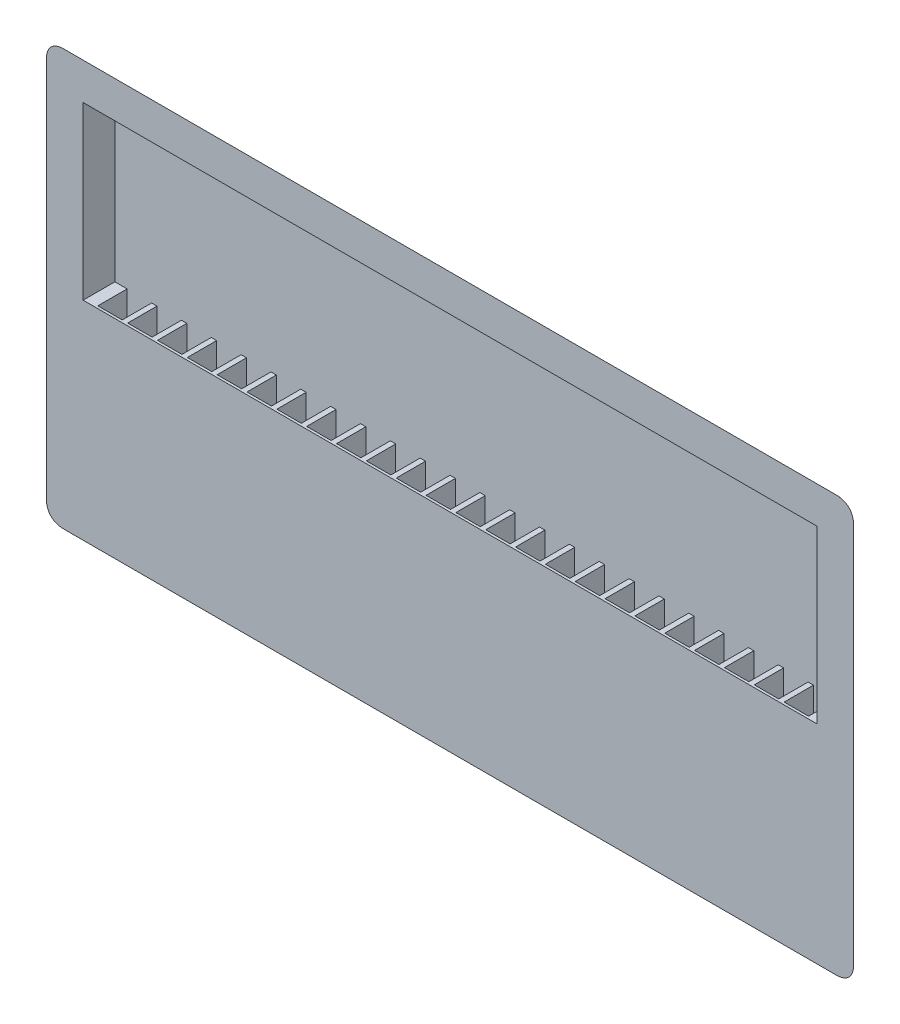
from build123d import *

# Parameters (mm, degrees)
SZKIC1_W                    = 300
SZKIC1_H                    = 140
DODANIE_WYCI_GNI_CIE1_DEPTH = 15
DODANIE_WYCI_GNI_CIE1_DRAFT = -45
SZKIC2_W                    = 300
SZKIC2_H                    = 70
WYTNIJ_WYCI_GNI_CIE1_DEPTH  = 15
SZKIC3_W                    = 10
SZKIC3_H                    = 12
WYTNIJ_WYCI_GNI_CIE2_DEPTH  = 108
ZAOKR_GLENIE1_R             = 10


with BuildPart() as part:
    # Szkic1 → Dodanie-wyciągnięcie1 (with draft: the straight prism first)
    with BuildSketch(Plane.XY):
        Rectangle(SZKIC1_W, SZKIC1_H)
    extrude(amount=DODANIE_WYCI_GNI_CIE1_DEPTH)
    # Dodanie-wyciągnięcie1: the draft: its side faces are tilted about the plane it starts from
    dodanie_wyci_gni_cie1_sides = [part.faces().sort_by_distance(p)[0] for p in [
        (0, -70, 7.5),
        (150, 0, 7.5),
        (0, 70, 7.5),
        (-150, 0, 7.5),
    ]]
    draft(dodanie_wyci_gni_cie1_sides, Plane.XY, DODANIE_WYCI_GNI_CIE1_DRAFT)

    # Szkic2 → Wytnij-wyciągnięcie1 (cut)
    with BuildSketch(Plane(origin=(0, 0, 2), x_dir=(-1, 0, 0), z_dir=(0, 0, -1))):
        with Locations((0, 35)):
            Rectangle(SZKIC2_W, SZKIC2_H)
    extrude(amount=-WYTNIJ_WYCI_GNI_CIE1_DEPTH, mode=Mode.SUBTRACT)

    # Szkic3 → Wytnij-wyciągnięcie2 (cut)
    with BuildSketch(Plane(origin=(0, 0, 0), x_dir=(1, 0, 0), z_dir=(0, 1, 0))):
        with Locations((-140, -8)):
            Rectangle(SZKIC3_W, SZKIC3_H)
        with Locations((-127.8, -8)):
            Rectangle(SZKIC3_W, SZKIC3_H)
        with Locations((-115.6, -8)):
            Rectangle(SZKIC3_W, SZKIC3_H)
        with Locations((-103.4, -8)):
            Rectangle(SZKIC3_W, SZKIC3_H)
        with Locations((-91.2, -8)):
            Rectangle(SZKIC3_W, SZKIC3_H)
        with Locations((-79, -8)):
            Rectangle(SZKIC3_W, SZKIC3_H)
        with Locations((-66.8, -8)):
            Rectangle(SZKIC3_W, SZKIC3_H)
        with Locations((-54.6, -8)):
            Rectangle(SZKIC3_W, SZKIC3_H)
        with Locations((-42.4, -8)):
            Rectangle(SZKIC3_W, SZKIC3_H)
        with Locations((-30.2, -8)):
            Rectangle(SZKIC3_W, SZKIC3_H)
        with Locations((-18, -8)):
            Rectangle(SZKIC3_W, SZKIC3_H)
        with Locations((-5.8, -8)):
            Rectangle(SZKIC3_W, SZKIC3_H)
        with Locations((6.4, -8)):
            Rectangle(SZKIC3_W, SZKIC3_H)
        with Locations((18.6, -8)):
            Rectangle(SZKIC3_W, SZKIC3_H)
        with Locations((30.8, -8)):
            Rectangle(SZKIC3_W, SZKIC3_H)
        with Locations((43, -8)):
            Rectangle(SZKIC3_W, SZKIC3_H)
        with Locations((55.2, -8)):
            Rectangle(SZKIC3_W, SZKIC3_H)
        with Locations((67.4, -8)):
            Rectangle(SZKIC3_W, SZKIC3_H)
        with Locations((79.6, -8)):
            Rectangle(SZKIC3_W, SZKIC3_H)
        with Locations((91.8, -8)):
            Rectangle(SZKIC3_W, SZKIC3_H)
        with Locations((104, -8)):
            Rectangle(SZKIC3_W, SZKIC3_H)
        with Locations((116.2, -8)):
            Rectangle(SZKIC3_W, SZKIC3_H)
        with Locations((128.4, -8)):
            Rectangle(SZKIC3_W, SZKIC3_H)
        with Locations((140.6, -8)):
            Rectangle(SZKIC3_W, SZKIC3_H)
    extrude(amount=-WYTNIJ_WYCI_GNI_CIE2_DEPTH, mode=Mode.SUBTRACT)

    # Zaokrąglenie1
    # the kernel refuses this fillet: 10 mm, written as the material it takes off along each edge
    with BuildSketch(Plane(origin=(-145.857864376, 65.857864376, 10), x_dir=(-0.35740674433659364, 0.8628562094610169, 0.3574067443365923), z_dir=(-0.2705980500730978, 0.2705980500730978, -0.9238795325112871))) as zaokr_glenie1_piece_1_section:
        Polygon((-13.907299812, -13.907299812), (13.907299812, -13.907299812), (13.907299812, 13.907299812), (-13.907299812, 13.907299812), align=None)
    zaokr_glenie1_piece_1 = extrude(amount=13.907299812, mode=Mode.PRIVATE)
    zaokr_glenie1_piece_1 = split(zaokr_glenie1_piece_1, bisect_by=Plane(origin=(-145.857864376, 65.857864376, 10), z_dir=(0, 1, 0)), keep=Keep.TOP, mode=Mode.PRIVATE)
    zaokr_glenie1_piece_1 = split(zaokr_glenie1_piece_1, bisect_by=Plane(origin=(-145.857864376, 65.857864376, 10), z_dir=(-1, 0, 0)), keep=Keep.TOP, mode=Mode.PRIVATE)
    zaokr_glenie1_piece_1 = split(zaokr_glenie1_piece_1, bisect_by=Plane(origin=(-145.857864376, 65.857864376, 10), z_dir=(0.5773502691896265, -0.5773502691896265, -0.5773502691896244)), keep=Keep.TOP, mode=Mode.PRIVATE)
    zaokr_glenie1_piece_1 = split(zaokr_glenie1_piece_1, bisect_by=Plane(origin=(-152.928932188, 65.857864376, 2.928932188), z_dir=(0.7071067811865462, 0, 0.7071067811865488)), keep=Keep.TOP, mode=Mode.PRIVATE)
    zaokr_glenie1_piece_1 = split(zaokr_glenie1_piece_1, bisect_by=Plane(origin=(-145.857864376, 65.857864376, 0), z_dir=(0, 0, 1)), keep=Keep.TOP, mode=Mode.PRIVATE)
    zaokr_glenie1_piece_1 = split(zaokr_glenie1_piece_1, bisect_by=Plane(origin=(-145.857864376, 72.928932188, 2.928932188), z_dir=(0, -0.7071067811865462, 0.7071067811865488)), keep=Keep.TOP, mode=Mode.PRIVATE)
    zaokr_glenie1_piece_1 = zaokr_glenie1_piece_1 - Plane(origin=(-145.857864376, 65.857864376, 10), x_dir=(0.2705980500730978, -0.2705980500730978, 0.9238795325112871), z_dir=(-0.35740674433659364, 0.8628562094610169, 0.3574067443365923)) * Sphere(ZAOKR_GLENIE1_R, mode=Mode.PRIVATE)
    add(zaokr_glenie1_piece_1, mode=Mode.SUBTRACT)
    with BuildSketch(Plane(origin=(145.857864376, 65.857864376, 10), x_dir=(-0.7071067811865475, 0.7071067811865475, 0), z_dir=(0.2705980500730978, 0.2705980500730978, -0.9238795325112871))) as zaokr_glenie1_piece_2_section:
        Polygon((-13.907299812, -13.907299812), (13.907299812, -13.907299812), (13.907299812, 13.907299812), (-13.907299812, 13.907299812), align=None)
    zaokr_glenie1_piece_2 = extrude(amount=13.907299812, mode=Mode.PRIVATE)
    zaokr_glenie1_piece_2 = split(zaokr_glenie1_piece_2, bisect_by=Plane(origin=(145.857864376, 65.857864376, 10), z_dir=(0, 1, 0)), keep=Keep.TOP, mode=Mode.PRIVATE)
    zaokr_glenie1_piece_2 = split(zaokr_glenie1_piece_2, bisect_by=Plane(origin=(145.857864376, 65.857864376, 10), z_dir=(-0.5773502691896265, -0.5773502691896265, -0.5773502691896244)), keep=Keep.TOP, mode=Mode.PRIVATE)
    zaokr_glenie1_piece_2 = split(zaokr_glenie1_piece_2, bisect_by=Plane(origin=(145.857864376, 65.857864376, 10), z_dir=(1, 0, 0)), keep=Keep.TOP, mode=Mode.PRIVATE)
    zaokr_glenie1_piece_2 = split(zaokr_glenie1_piece_2, bisect_by=Plane(origin=(145.857864376, 65.857864376, 0), z_dir=(0, 0, 1)), keep=Keep.TOP, mode=Mode.PRIVATE)
    zaokr_glenie1_piece_2 = split(zaokr_glenie1_piece_2, bisect_by=Plane(origin=(152.928932188, 65.857864376, 2.928932188), z_dir=(-0.7071067811865462, 0, 0.7071067811865488)), keep=Keep.TOP, mode=Mode.PRIVATE)
    zaokr_glenie1_piece_2 = split(zaokr_glenie1_piece_2, bisect_by=Plane(origin=(145.857864376, 72.928932188, 2.928932188), z_dir=(0, -0.7071067811865462, 0.7071067811865488)), keep=Keep.TOP, mode=Mode.PRIVATE)
    zaokr_glenie1_piece_2 = zaokr_glenie1_piece_2 - Plane(origin=(145.857864376, 65.857864376, 10), x_dir=(-0.2705980500730978, -0.2705980500730978, 0.9238795325112871), z_dir=(-0.7071067811865475, 0.7071067811865475, 0)) * Sphere(ZAOKR_GLENIE1_R, mode=Mode.PRIVATE)
    add(zaokr_glenie1_piece_2, mode=Mode.SUBTRACT)
    with BuildSketch(Plane(origin=(-150, 65.857864376, 0), x_dir=(-0.7071067811865438, 0, 0.7071067811865511), z_dir=(0, -1, 0))) as zaokr_glenie1_piece_3:
        with BuildLine():
            CenterArc((ZAOKR_GLENIE1_R * 0.414213562373, -ZAOKR_GLENIE1_R), ZAOKR_GLENIE1_R, 90, 45)
            Line((-ZAOKR_GLENIE1_R * 0.292893218813, -ZAOKR_GLENIE1_R * 0.292893218813), (0, 0))
            Line((0, 0), (ZAOKR_GLENIE1_R * 0.414213562373, 0))
        make_face()
    extrude(amount=146.213203436, mode=Mode.SUBTRACT)
    with BuildSketch(Plane(origin=(145.857864376, 70, 0), x_dir=(0, -1, 0), z_dir=(-1, 0, 0))) as zaokr_glenie1_piece_4:
        with BuildLine():
            CenterArc((ZAOKR_GLENIE1_R * 0.414213562373, ZAOKR_GLENIE1_R), ZAOKR_GLENIE1_R, 225, 45)
            Line((-ZAOKR_GLENIE1_R * 0.292893218813, ZAOKR_GLENIE1_R * 0.292893218813), (0, 0))
            Line((0, 0), (ZAOKR_GLENIE1_R * 0.414213562373, 0))
        make_face()
    extrude(amount=291.715728753, mode=Mode.SUBTRACT)
    with BuildSketch(Plane(origin=(150, -80.355339059, 0), x_dir=(-1, 0, 0), z_dir=(0, 1, 0))) as zaokr_glenie1_piece_5:
        with BuildLine():
            CenterArc((ZAOKR_GLENIE1_R * 0.414213562373, ZAOKR_GLENIE1_R), ZAOKR_GLENIE1_R, 225, 45)
            Line((-ZAOKR_GLENIE1_R * 0.292893218813, ZAOKR_GLENIE1_R * 0.292893218813), (0, 0))
            Line((0, 0), (ZAOKR_GLENIE1_R * 0.414213562373, 0))
        make_face()
    extrude(amount=146.213203436, mode=Mode.SUBTRACT)
    with BuildSketch(Plane(origin=(141.666666667, -61.666666667, -8.333333333), x_dir=(-0.8164965809277256, -0.40824829046386363, 0.40824829046386335), z_dir=(0.5773502691896265, -0.5773502691896265, 0.5773502691896244))) as zaokr_glenie1_piece_6:
        with BuildLine():
            CenterArc((ZAOKR_GLENIE1_R * 0.57735026919, -ZAOKR_GLENIE1_R), ZAOKR_GLENIE1_R, 90, 60)
            Line((-ZAOKR_GLENIE1_R * 0.288675134595, -ZAOKR_GLENIE1_R * 0.5), (0, 0))
            Line((0, 0), (ZAOKR_GLENIE1_R * 0.57735026919, 0))
        make_face()
    extrude(amount=54.848275573, mode=Mode.SUBTRACT)
    with BuildSketch(Plane(origin=(-141.666666667, -61.666666667, -8.333333333), x_dir=(0.8164965809277256, -0.40824829046386546, 0.40824829046386146), z_dir=(-0.5773502691896265, -0.5773502691896265, 0.5773502691896244))) as zaokr_glenie1_piece_7:
        with BuildLine():
            CenterArc((ZAOKR_GLENIE1_R * 0.57735026919, ZAOKR_GLENIE1_R), ZAOKR_GLENIE1_R, 210, 60)
            Line((-ZAOKR_GLENIE1_R * 0.288675134595, ZAOKR_GLENIE1_R * 0.5), (0, 0))
            Line((0, 0), (ZAOKR_GLENIE1_R * 0.57735026919, 0))
        make_face()
    extrude(amount=54.848275573, mode=Mode.SUBTRACT)
    with BuildSketch(Plane(origin=(-150.571909584, 70.571909584, 0.571909584), x_dir=(-0.4082482904638678, -0.8164965809277256, 0.40824829046385913), z_dir=(-0.5773502691896265, 0.5773502691896265, 0.5773502691896244))) as zaokr_glenie1_piece_8:
        with BuildLine():
            CenterArc((ZAOKR_GLENIE1_R * 0.57735026919, ZAOKR_GLENIE1_R), ZAOKR_GLENIE1_R, 210, 60)
            Line((-ZAOKR_GLENIE1_R * 0.288675134595, ZAOKR_GLENIE1_R * 0.5), (0, 0))
            Line((0, 0), (ZAOKR_GLENIE1_R * 0.57735026919, 0))
        make_face()
    extrude(amount=39.423942386, mode=Mode.SUBTRACT)
    with BuildSketch(Plane(origin=(150.571909584, 70.571909584, 0.571909584), x_dir=(0.4082482904638637, -0.8164965809277256, 0.4082482904638634), z_dir=(0.5773502691896265, 0.5773502691896265, 0.5773502691896244))) as zaokr_glenie1_piece_9:
        with BuildLine():
            CenterArc((ZAOKR_GLENIE1_R * 0.57735026919, -ZAOKR_GLENIE1_R), ZAOKR_GLENIE1_R, 90, 60)
            Line((-ZAOKR_GLENIE1_R * 0.288675134595, -ZAOKR_GLENIE1_R * 0.5), (0, 0))
            Line((0, 0), (ZAOKR_GLENIE1_R * 0.57735026919, 0))
        make_face()
    extrude(amount=39.423942386, mode=Mode.SUBTRACT)


solid = part.part
